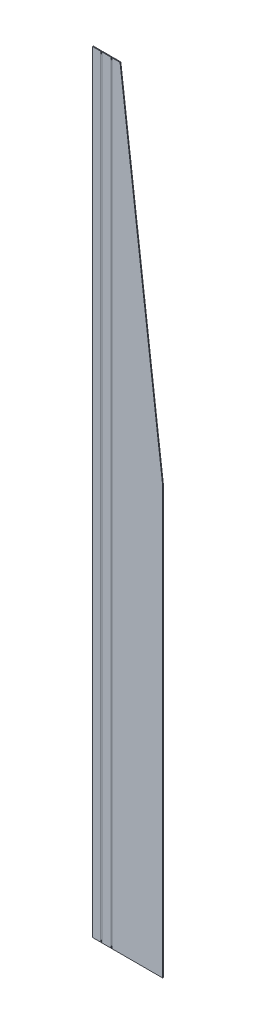
from build123d import *

# Parameters (mm, degrees)
BRIDA_BASE4_DEPTH          = 1810
CORTAR_EXTRUIR1_DEPTH      = 1812.988923807
CORTAR_EXTRUIR1_DEPTH_BACK = 1812.988923807
DESDOBLAR1_DEPTH           = 1810
DESDOBLAR1_2_DEPTH         = 1810
CORTAR_EXTRUIR2_DEPTH      = 1813.989374608
CORTAR_EXTRUIR2_DEPTH_BACK = 1813.989374608


# Read off the part's stored shape, not the designer's step: Desdoblar1
# Sheet-metal steps are written as plain solids
with BuildPart() as part:
    # Croquis1 → Brida base4 (new body)
    with BuildSketch(Plane(origin=(0, 0, 0), x_dir=(1, 0, 0), z_dir=(0, 1, 0))):
        with BuildLine():
            Line((60.5, 0), (-57.8634, 0))
            ThreePointArc((-57.8634, 0), (-59.727757739, 0.772242261), (-60.5, 2.6366))
            Line((-60.5, 2.6366), (-60.5, 24.2634))
            ThreePointArc((-60.5, 24.2634), (-60.715745145, 24.784254855), (-61.2366, 25))
            Line((-61.2366, 25), (-80.5, 25))
            Line((-80.5, 25), (-80.5, 26.9))
            Line((-80.5, 26.9), (-61.2366, 26.9))
            ThreePointArc((-61.2366, 26.9), (-59.372242261, 26.127757739), (-58.6, 24.2634))
            Line((-58.6, 24.2634), (-58.6, 2.6366))
            ThreePointArc((-58.6, 2.6366), (-58.384254855, 2.115745145), (-57.8634, 1.9))
            Line((-57.8634, 1.9), (60.5, 1.9))
            Line((60.5, 1.9), (60.5, 0))
        make_face()
    extrude(amount=BRIDA_BASE4_DEPTH)

    # Croquis19 → Cortar-Extruir1 (cut, two sides: drawn at the far end of the back side and taken through both)
    with BuildSketch(Plane.XY.offset(-CORTAR_EXTRUIR1_DEPTH_BACK)):
        Polygon((60.5, 1000), (-39.5, 1810), (-39.5, 1900.089959651), (60.5, 1900.089959651), align=None)
    extrude(amount=CORTAR_EXTRUIR1_DEPTH + CORTAR_EXTRUIR1_DEPTH_BACK, mode=Mode.SUBTRACT)

    # Desdoblar1 outline → Desdoblar1 (cut)
    with BuildSketch(Plane(origin=(0, 0, 0), x_dir=(1, 0, 0), z_dir=(0, 1, 0))):
        with BuildLine():
            ThreePointArc((-60.5, 2.6366), (-60.473622072, 2.264578098), (-60.395016084, 1.9))
            Line((-60.395016084, 1.9), (-57.8634, 1.9))
            ThreePointArc((-57.8634, 1.9), (-58.384254855, 2.115745145), (-58.6, 2.6366))
            Line((-58.6, 2.6366), (-58.6, 24.2634))
            ThreePointArc((-58.6, 24.2634), (-59.372242261, 26.127757739), (-61.2366, 26.9))
            Line((-61.2366, 26.9), (-80.5, 26.9))
            Line((-80.5, 26.9), (-80.5, 25))
            Line((-80.5, 25), (-61.2366, 25))
            ThreePointArc((-61.2366, 25), (-60.715745145, 24.784254855), (-60.5, 24.2634))
            Line((-60.5, 24.2634), (-60.5, 2.6366))
        make_face()
    extrude(amount=DESDOBLAR1_DEPTH, mode=Mode.SUBTRACT)

    # Desdoblar1 2 outline → Desdoblar1 2 (add)
    with BuildSketch(Plane(origin=(0, 0, 0), x_dir=(1, 0, 0), z_dir=(0, 1, 0))):
        with BuildLine():
            Line((-104.05221017, 0), (-57.8634, 0))
            ThreePointArc((-57.8634, 0), (-59.446046517, 0.527835063), (-60.395016084, 1.9))
            Line((-60.395016084, 1.9), (-104.05221017, 1.9))
            Line((-104.05221017, 1.9), (-104.05221017, 0))
        make_face()
    extrude(amount=DESDOBLAR1_2_DEPTH)

    # Croquis20 → Cortar-Extruir2 (cut, two sides: drawn at the far end of the back side and taken through both)
    with BuildSketch(Plane.XY.offset(-CORTAR_EXTRUIR2_DEPTH_BACK)):
        with BuildLine():
            ThreePointArc((-82.464157627, 1805.95), (-82.742406185, 1805.278248558), (-83.414157627, 1805))
            Line((-83.414157627, 1805), (-83.514157627, 1805))
            ThreePointArc((-83.514157627, 1805), (-84.185909069, 1805.278248558), (-84.464157627, 1805.95))
            Line((-84.464157627, 1805.95), (-84.464157627, 1810))
            Line((-84.464157627, 1810), (-82.464157627, 1810))
            Line((-82.464157627, 1810), (-82.464157627, 1805.95))
        make_face()
        with BuildLine():
            ThreePointArc((-58.188052542, 1805.95), (-58.4663011, 1805.278248558), (-59.138052542, 1805))
            Line((-59.138052542, 1805), (-59.238052542, 1805))
            ThreePointArc((-59.238052542, 1805), (-59.909803985, 1805.278248558), (-60.188052542, 1805.95))
            Line((-60.188052542, 1805.95), (-60.188052542, 1810))
            Line((-60.188052542, 1810), (-58.188052542, 1810))
            Line((-58.188052542, 1810), (-58.188052542, 1805.95))
        make_face()
        with BuildLine():
            ThreePointArc((-84.464157627, 4.05), (-84.185909069, 4.721751442), (-83.514157627, 5))
            Line((-83.514157627, 5), (-83.414157627, 5))
            ThreePointArc((-83.414157627, 5), (-82.742406185, 4.721751442), (-82.464157627, 4.05))
            Line((-82.464157627, 4.05), (-82.464157627, 0))
            Line((-82.464157627, 0), (-84.464157627, 0))
            Line((-84.464157627, 0), (-84.464157627, 4.05))
        make_face()
        with BuildLine():
            ThreePointArc((-60.188052542, 4.05), (-59.909803985, 4.721751442), (-59.238052542, 5))
            Line((-59.238052542, 5), (-59.138052542, 5))
            ThreePointArc((-59.138052542, 5), (-58.4663011, 4.721751442), (-58.188052542, 4.05))
            Line((-58.188052542, 4.05), (-58.188052542, 0))
            Line((-58.188052542, 0), (-60.188052542, 0))
            Line((-60.188052542, 0), (-60.188052542, 4.05))
        make_face()
    extrude(amount=CORTAR_EXTRUIR2_DEPTH + CORTAR_EXTRUIR2_DEPTH_BACK, mode=Mode.SUBTRACT)


solid = part.part
